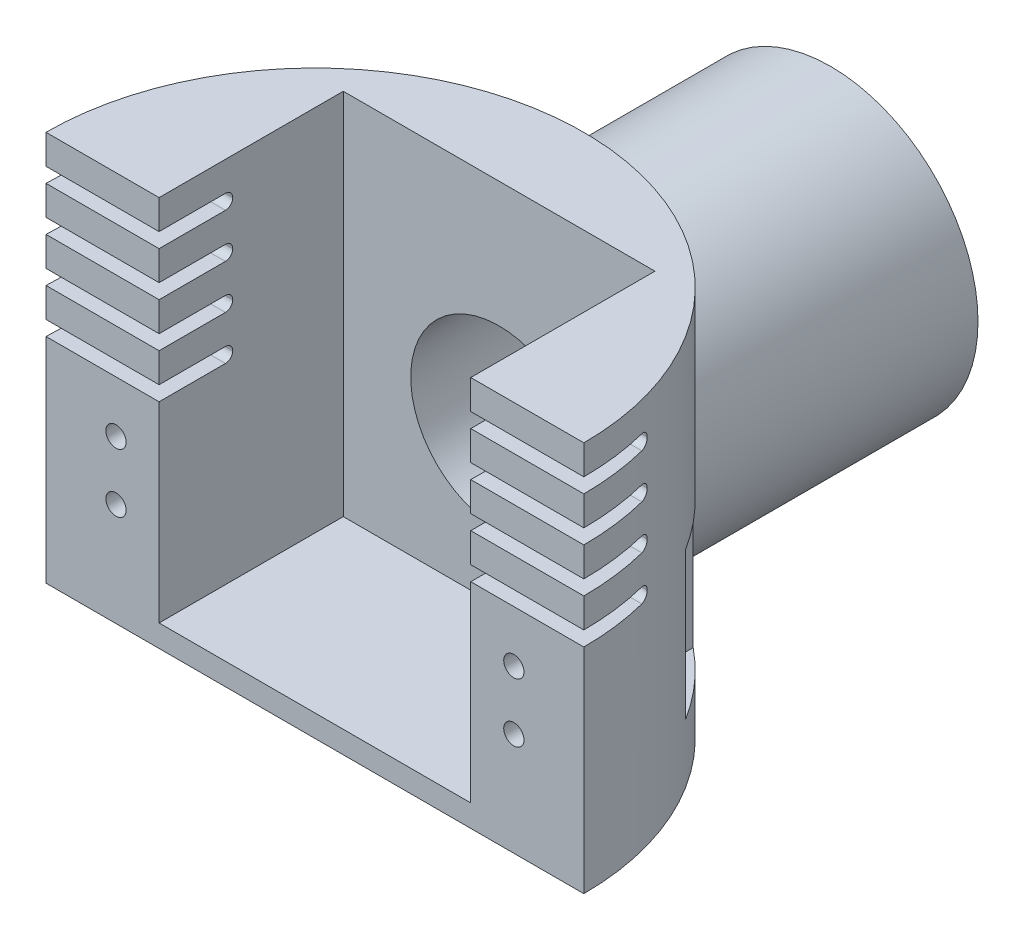
from build123d import *

# Parameters (mm, degrees)
SKETCH1_R                = 36.5
BOSS_EXTRUDE1_DEPTH      = 3
BOSS_EXTRUDE2_DEPTH      = 7
CUT_EXTRUDE1_REACH       = 54.091
SKETCH3_R                = 4.15
BOSS_EXTRUDE3_DEPTH      = 8
SKETCH5_R                = 36.5
BOSS_EXTRUDE4_DEPTH      = 5
SKETCH6_R                = 36.5
SKETCH6_W                = 42.3
SKETCH6_H                = 50
BOSS_EXTRUDE5_DEPTH      = 50
CUT_EXTRUDE3_DEPTH       = 12
BOSS_EXTRUDE6_REACH      = 136.177
BOSS_EXTRUDE6_END_RADIUS = 36.5
SKETCH10_R               = 20
SKETCH8_W                = 73
SKETCH8_H                = 36.5
CUT_EXTRUDE4_DEPTH       = 108.523253466
CUT_EXTRUDE5_REACH       = 95.2
SKETCH9_R                = 4
SKETCH11_R               = 11
CUT_EXTRUDE6_DEPTH       = 7
SKETCH12_R               = 12
CUT_EXTRUDE7_DEPTH       = 35
CUT_EXTRUDE9_REACH       = 104.738
CUT_EXTRUDE9_END_RADIUS  = 36.5
SKETCH13_W               = 8
SKETCH13_H               = 20
CUT_EXTRUDE10_REACH      = 104.738
SKETCH14_R               = 1.375
SKETCH16_R               = 2.65
CUT_EXTRUDE14_DEPTH      = 2.6
SKETCH17_W               = 10
SKETCH17_H               = 2
CUT_EXTRUDE15_DEPTH      = 125.73171226
FILLET1_R                = 1
SKETCH19_R               = 36.5
CUT_EXTRUDE16_DEPTH      = 20


with BuildPart() as part:
    # Sketch1 → Boss-Extrude1 (new body)
    with BuildSketch(Plane(origin=(0, 0, 0), x_dir=(1, 0, 0), z_dir=(0, 1, 0))):
        with Locations(Location((0, 0, 0), (0, 0, 270))):
            Circle(SKETCH1_R)
    extrude(amount=BOSS_EXTRUDE1_DEPTH)

    # Sketch2 → Boss-Extrude2 (add)
    with BuildSketch(Plane(origin=(0, 3, 0), x_dir=(1, 0, 0), z_dir=(0, 1, 0))):
        with BuildLine():
            Line((-11, 0), (-11, -34.803017111))
            ThreePointArc((-11, -34.803017111), (0, 36.5), (11, -34.803017111))
            Line((11, -34.803017111), (11, 0))
            ThreePointArc((11, 0), (0, 11), (-11, 0))
        make_face()
    extrude(amount=BOSS_EXTRUDE2_DEPTH)

    # Sketch3 → Cut-Extrude1 (cut, up to next)
    with BuildSketch(Plane(origin=(0, 3, 0), x_dir=(1, 0, 0), z_dir=(0, 1, 0)), mode=Mode.PRIVATE) as cut_extrude1_sk1:
        with Locations(Location((0, 0, 0), (0, 0, 270))):
            Circle(SKETCH3_R)
    cut_extrude1_tool1 = extrude(cut_extrude1_sk1.sketch, amount=-CUT_EXTRUDE1_REACH, mode=Mode.PRIVATE) & part.part
    add(cut_extrude1_tool1.solids().sort_by_distance((0, 3, 0))[0], mode=Mode.SUBTRACT)

    # Sketch4 → Boss-Extrude3 (add)
    with BuildSketch(Plane(origin=(0, 10, 0), x_dir=(1, 0, 0), z_dir=(0, 1, 0))):
        with BuildLine():
            Line((-11, -34.803017111), (-11, 0))
            ThreePointArc((-11, 0), (0, 11), (11, 0))
            Line((11, 0), (11, -34.803017111))
            ThreePointArc((11, -34.803017111), (0, 36.5), (-11, -34.803017111))
        make_face()
        with BuildLine():
            Line((-6.35, -35.943392995), (-6.35, -3.666174209))
            Line((-6.35, -3.666174209), (-6.35, 3.666174209))
            Line((-6.35, 3.666174209), (0, 7.332348419))
            Line((0, 7.332348419), (6.35, 3.666174209))
            Line((6.35, 3.666174209), (6.35, -3.666174209))
            Line((6.35, -3.666174209), (6.35, -35.943392995))
            ThreePointArc((6.35, -35.943392995), (8.693718381, -35.449531178), (11, -34.803017111))
            Line((11, -34.803017111), (11, 0))
            ThreePointArc((11, 0), (0, 11), (-11, 0))
            Line((-11, 0), (-11, -34.803017111))
            ThreePointArc((-11, -34.803017111), (-8.693718381, -35.449531178), (-6.35, -35.943392995))
        make_face()
    extrude(amount=BOSS_EXTRUDE3_DEPTH)

    # Sketch5 → Boss-Extrude4 (add)
    with BuildSketch(Plane(origin=(0, 18, 0), x_dir=(1, 0, 0), z_dir=(0, 1, 0))):
        with Locations(Location((0, 0, 0), (0, 0, 270))):
            Circle(SKETCH5_R)
    extrude(amount=BOSS_EXTRUDE4_DEPTH)

    # Sketch6 → Boss-Extrude5 (add)
    with BuildSketch(Plane(origin=(0, 23, 0), x_dir=(1, 0, 0), z_dir=(0, 1, 0))):
        with Locations(Location((0, 0, 0), (0, 0, 270))):
            Circle(SKETCH6_R)
        Rectangle(SKETCH6_W, SKETCH6_H, mode=Mode.SUBTRACT)
    extrude(amount=BOSS_EXTRUDE5_DEPTH)

    # Sketch7 → Cut-Extrude3 (cut)
    with BuildSketch(Plane(origin=(0, 0, 36.5), x_dir=(-1, 0, 0), z_dir=(0, 0, -1))):
        with BuildLine():
            Line((-15.133297532, 2.000141036), (14.866702468, 2.000141036))
            ThreePointArc((14.866702468, 2.000141036), (24.955572938, 11.955409186), (14.955572938, 21.999943586))
            Line((14.955572938, 21.999943586), (-15.044427062, 21.999943586))
            ThreePointArc((-15.044427062, 21.999943586), (-25.044427062, 12.044280534), (-15.133297532, 2.000141036))
        make_face()
    extrude(amount=CUT_EXTRUDE3_DEPTH, mode=Mode.SUBTRACT)

    # Boss-Extrude6: up to this cylinder (the profile starts outside it)
    boss_extrude6_end = Plane(origin=(0, 44, 0), z_dir=(0, -1, 0)) * Cylinder(BOSS_EXTRUDE6_END_RADIUS, 346.354, mode=Mode.PRIVATE)
    # Sketch10 → Boss-Extrude6 (add, up to the surface)
    with BuildSketch(Plane.XY.offset(-70), mode=Mode.PRIVATE) as boss_extrude6_sk1:
        with Locations(Location((0, 44, 0), (0, 0, 90))):
            Circle(SKETCH10_R)
    boss_extrude6_tool1 = extrude(boss_extrude6_sk1.sketch, amount=BOSS_EXTRUDE6_REACH, mode=Mode.PRIVATE) - boss_extrude6_end
    add(boss_extrude6_tool1.solids().sort_by_distance((0, 44, -70))[0])

    # Sketch8 → Cut-Extrude4 (cut, through all)
    with BuildSketch(Plane(origin=(0, 73, 0), x_dir=(1, 0, 0), z_dir=(0, 1, 0))):
        with Locations((0, -18.25)):
            Rectangle(SKETCH8_W, SKETCH8_H)
    extrude(amount=-CUT_EXTRUDE4_DEPTH, mode=Mode.SUBTRACT)

    # Sketch9 → Cut-Extrude5 (cut, up to next)
    with BuildSketch(Plane.XY.offset(-25), mode=Mode.PRIVATE) as cut_extrude5_sk1:
        with Locations((0, 44)):
            Circle(SKETCH9_R)
    cut_extrude5_tool1 = extrude(cut_extrude5_sk1.sketch, amount=-CUT_EXTRUDE5_REACH, mode=Mode.PRIVATE) & part.part
    add(cut_extrude5_tool1.solids().sort_by_distance((0, 44, -25))[0], mode=Mode.SUBTRACT)

    # Sketch11 → Cut-Extrude6 (cut)
    with BuildSketch(Plane(origin=(0, 0, -70), x_dir=(-1, 0, 0), z_dir=(0, 0, -1))):
        with Locations((0, 44)):
            Circle(SKETCH11_R)
    extrude(amount=-CUT_EXTRUDE6_DEPTH, mode=Mode.SUBTRACT)

    # Sketch12 → Cut-Extrude7 (cut)
    with BuildSketch(Plane.XY.offset(-25)):
        with Locations((0, 44)):
            Circle(SKETCH12_R)
    extrude(amount=-CUT_EXTRUDE7_DEPTH, mode=Mode.SUBTRACT)

    # Cut-Extrude9: up to this cylinder (the profile starts inside it)
    cut_extrude9_end = Plane(origin=(0, 38, 0), z_dir=(0, -1, 0)) * Cylinder(CUT_EXTRUDE9_END_RADIUS, 283.476, mode=Mode.PRIVATE)
    # Sketch13 → Cut-Extrude9 (cut, up to the surface)
    with BuildSketch(Plane.XY.offset(-7.6), mode=Mode.PRIVATE) as cut_extrude9_sk1:
        with Locations((-27, 38)):
            Rectangle(SKETCH13_W, SKETCH13_H)
    cut_extrude9_tool1 = extrude(cut_extrude9_sk1.sketch, amount=-CUT_EXTRUDE9_REACH, mode=Mode.PRIVATE) & cut_extrude9_end
    add(cut_extrude9_tool1.solids().sort_by_distance((-27, 38, -7.6))[0], mode=Mode.SUBTRACT)
    # Sketch13 → Cut-Extrude9 (cut, up to the surface)
    with BuildSketch(Plane.XY.offset(-7.6), mode=Mode.PRIVATE) as cut_extrude9_sk2:
        with Locations((27, 38)):
            Rectangle(SKETCH13_W, SKETCH13_H)
    cut_extrude9_tool2 = extrude(cut_extrude9_sk2.sketch, amount=-CUT_EXTRUDE9_REACH, mode=Mode.PRIVATE) & cut_extrude9_end
    add(cut_extrude9_tool2.solids().sort_by_distance((27, 38, -7.6))[0], mode=Mode.SUBTRACT)

    # Sketch14 → Cut-Extrude10 (cut, up to next)
    with BuildSketch(Plane(origin=(0, 0, -7.6), x_dir=(-1, 0, 0), z_dir=(0, 0, -1)), mode=Mode.PRIVATE) as cut_extrude10_sk1:
        with Locations((27, 42)):
            Circle(SKETCH14_R)
    cut_extrude10_tool1 = extrude(cut_extrude10_sk1.sketch, amount=-CUT_EXTRUDE10_REACH, mode=Mode.PRIVATE) & part.part
    # Sketch14 → Cut-Extrude10 (cut, up to next)
    with BuildSketch(Plane(origin=(0, 0, -7.6), x_dir=(-1, 0, 0), z_dir=(0, 0, -1)), mode=Mode.PRIVATE) as cut_extrude10_sk2:
        with Locations((27, 34)):
            Circle(SKETCH14_R)
    cut_extrude10_tool2 = extrude(cut_extrude10_sk2.sketch, amount=-CUT_EXTRUDE10_REACH, mode=Mode.PRIVATE) & part.part
    # Sketch14 → Cut-Extrude10 (cut, up to next)
    with BuildSketch(Plane(origin=(0, 0, -7.6), x_dir=(-1, 0, 0), z_dir=(0, 0, -1)), mode=Mode.PRIVATE) as cut_extrude10_sk3:
        with Locations((-27, 42)):
            Circle(SKETCH14_R)
    cut_extrude10_tool3 = extrude(cut_extrude10_sk3.sketch, amount=-CUT_EXTRUDE10_REACH, mode=Mode.PRIVATE) & part.part
    # Sketch14 → Cut-Extrude10 (cut, up to next)
    with BuildSketch(Plane(origin=(0, 0, -7.6), x_dir=(-1, 0, 0), z_dir=(0, 0, -1)), mode=Mode.PRIVATE) as cut_extrude10_sk4:
        with Locations((-27, 34)):
            Circle(SKETCH14_R)
    cut_extrude10_tool4 = extrude(cut_extrude10_sk4.sketch, amount=-CUT_EXTRUDE10_REACH, mode=Mode.PRIVATE) & part.part
    add(cut_extrude10_tool1.solids().sort_by_distance((-27, 42, -7.6))[0], mode=Mode.SUBTRACT)
    add(cut_extrude10_tool2.solids().sort_by_distance((-27, 34, -7.6))[0], mode=Mode.SUBTRACT)
    add(cut_extrude10_tool3.solids().sort_by_distance((27, 42, -7.6))[0], mode=Mode.SUBTRACT)
    add(cut_extrude10_tool4.solids().sort_by_distance((27, 34, -7.6))[0], mode=Mode.SUBTRACT)

    # Sketch16 → Cut-Extrude14 (cut)
    with BuildSketch(Plane(origin=(0, 0, -7.6), x_dir=(-1, 0, 0), z_dir=(0, 0, -1))):
        with Locations((-27, 42)):
            Circle(SKETCH16_R)
        with Locations((-27, 34)):
            Circle(SKETCH16_R)
        with Locations((27, 42)):
            Circle(SKETCH16_R)
        with Locations((27, 34)):
            Circle(SKETCH16_R)
    extrude(amount=-CUT_EXTRUDE14_DEPTH, mode=Mode.SUBTRACT)

    # Sketch17 → Cut-Extrude15 (cut, through all)
    with BuildSketch(Plane(origin=(36.5, 0, 0), x_dir=(0, 0, -1), z_dir=(1, 0, 0))):
        with Locations((5, 68)):
            Rectangle(SKETCH17_W, SKETCH17_H)
        with Locations((5, 62)):
            Rectangle(SKETCH17_W, SKETCH17_H)
        with Locations((5, 56)):
            Rectangle(SKETCH17_W, SKETCH17_H)
        with Locations((5, 50)):
            Rectangle(SKETCH17_W, SKETCH17_H)
    extrude(amount=-CUT_EXTRUDE15_DEPTH, mode=Mode.SUBTRACT)

    # Fillet1
    fillet1_edges = [part.edges().sort_by_distance(p)[0] for p in [
        (-28.126709318, 49, -10),
        (-28.126709318, 55, -10),
        (-28.126709318, 61, -10),
        (-28.126709318, 67, -10),
        (28.126709318, 67, -10),
        (28.126709318, 61, -10),
        (28.126709318, 55, -10),
        (28.126709318, 49, -10),
        (28.126709318, 51, -10),
        (28.126709318, 57, -10),
        (28.126709318, 63, -10),
        (28.126709318, 69, -10),
        (-28.126709318, 51, -10),
        (-28.126709318, 57, -10),
        (-28.126709318, 63, -10),
        (-28.126709318, 69, -10),
    ]]
    fillet(fillet1_edges, radius=FILLET1_R - 0.0001)  # a hair under: the kernel refuses the full size

    # Sketch19 → Cut-Extrude16 (cut)
    with BuildSketch(Plane.XZ):
        Circle(SKETCH19_R)
    extrude(amount=-CUT_EXTRUDE16_DEPTH, mode=Mode.SUBTRACT)


solid = part.part
